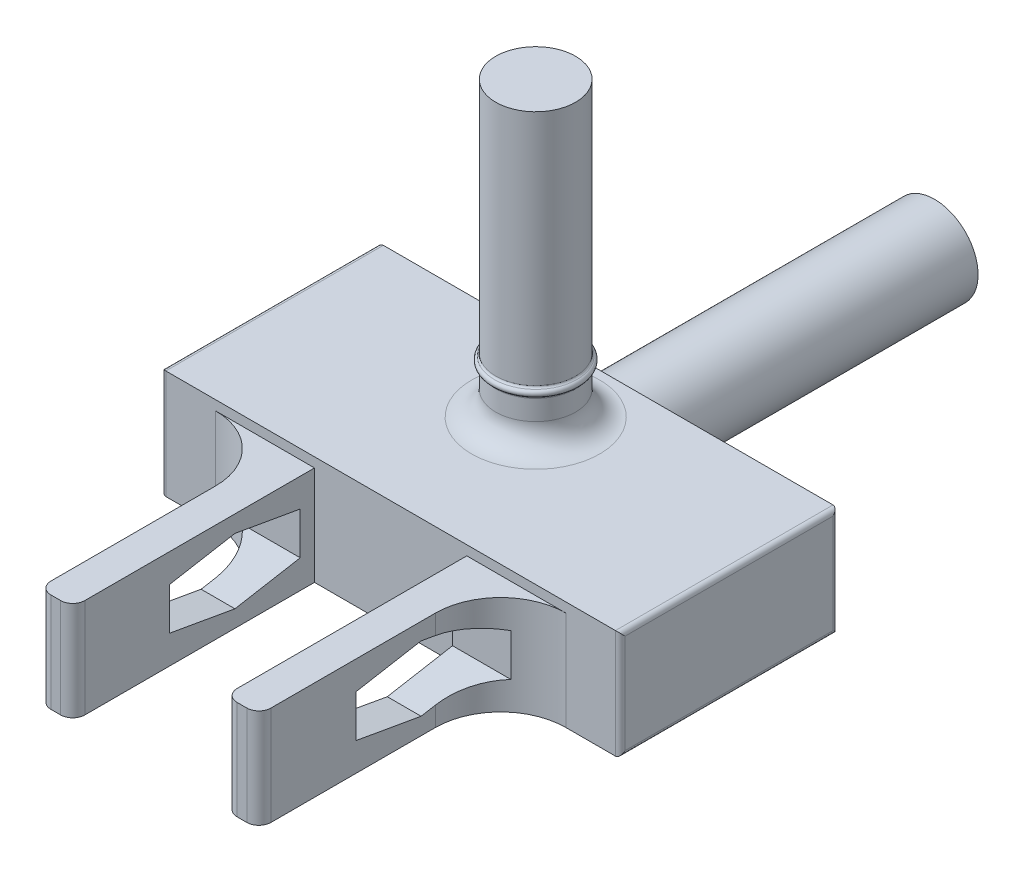
from build123d import *

# Parameters (mm, degrees)
DODANIE_WYCI_GNI_CIE1_DEPTH     = 4.5
DODANIE_WYCI_GNI_CIE2_DEPTH     = 4.1
SZKIC2_R                        = 1.8
DODANIE_WYCI_GNI_CIE3_DEPTH     = 13.5
WYTNIJ_WYCI_GNI_CIE2_DEPTH      = 23.456012558
WYTNIJ_WYCI_GNI_CIE2_DEPTH_BACK = 23.456012558
ZAOKR_GLENIE1_R                 = 0.5
ZAOKR_GLENIE2_R                 = 0.2
SZKIC4_R                        = 1.65
DODANIE_WYCI_GNI_CIE4_DEPTH     = 5.1
SZKIC5_R                        = 1.65
DODANIE_WYCI_GNI_CIE5_DEPTH     = 7
ZAOKR_GLENIE4_R                 = 1
SZKIC6_R                        = 0.15
ZAOKR_GLENIE6_R                 = 0.1


with BuildPart() as part:
    # Szkic1 → Dodanie-wyciągnięcie1 (new body)
    with BuildSketch(Plane(origin=(0, 0, 0), x_dir=(1, 0, 0), z_dir=(0, 1, 0))):
        Polygon((3.15, -4.5), (4.55, -4.5), (7.25, -4.5), (9.5, -4.5), (9.5, 4.5), (2.579268293, 4.5), (-2.579268293, 4.5), (-9.5, 4.5), (-9.5, -4.5), (-7.25, -4.5), (-4.55, -4.5), (-3.15, -4.5), align=None)
    extrude(amount=DODANIE_WYCI_GNI_CIE1_DEPTH)

    # Szkic1<7> → Dodanie-wyciągnięcie2 (add)
    with BuildSketch(Plane(origin=(0, 0, 0), x_dir=(1, 0, 0), z_dir=(0, 1, 0))):
        with BuildLine():
            Line((4.55, -14.5), (4.55, -7.2))
            ThreePointArc((4.55, -7.2), (5.340811691, -5.290811691), (7.25, -4.5))
            Line((7.25, -4.5), (3.15, -4.5))
            Line((3.15, -4.5), (3.15, -14.5))
            Line((3.15, -14.5), (4.55, -14.5))
        make_face()
        with BuildLine():
            Line((-3.15, -14.5), (-3.15, -4.5))
            Line((-3.15, -4.5), (-7.25, -4.5))
            ThreePointArc((-7.25, -4.5), (-5.340811691, -5.290811691), (-4.55, -7.2))
            Line((-4.55, -7.2), (-4.55, -14.5))
            Line((-4.55, -14.5), (-3.15, -14.5))
        make_face()
    extrude(amount=DODANIE_WYCI_GNI_CIE2_DEPTH)

    # Szkic2 → Dodanie-wyciągnięcie3 (add)
    with BuildSketch(Plane(origin=(0, 0, -4.5), x_dir=(-1, 0, 0), z_dir=(0, 0, -1))):
        with Locations((0, 2.25)):
            Circle(SZKIC2_R)
    extrude(amount=DODANIE_WYCI_GNI_CIE3_DEPTH)

    # Szkic3 → Wytnij-wyciągnięcie2 (cut, two sides: drawn at the far end of the back side and taken through both)
    with BuildSketch(Plane(origin=(-3.15, 0, 0), x_dir=(0, 0, -1), z_dir=(1, 0, 0)).offset(-WYTNIJ_WYCI_GNI_CIE2_DEPTH_BACK)):
        Polygon((-7.790001582, 3.4), (-10.490001582, 2.923917152), (-10.490001582, 1.176082848), (-7.790001582, 0.7), (-5.090001582, 1.176082848), (-5.090001582, 2.923917152), align=None)
    extrude(amount=WYTNIJ_WYCI_GNI_CIE2_DEPTH + WYTNIJ_WYCI_GNI_CIE2_DEPTH_BACK, mode=Mode.SUBTRACT)

    # Zaokrąglenie1
    zaokr_glenie1_edges = [part.edges().sort_by_distance(p)[0] for p in [
        (3.15, 2.05, 14.5),
        (4.55, 2.05, 14.5),
        (-4.55, 2.05, 14.5),
        (-3.15, 2.05, 14.5),
    ]]
    fillet(zaokr_glenie1_edges, radius=ZAOKR_GLENIE1_R)

    # Zaokrąglenie2
    zaokr_glenie2_edges = [part.edges().sort_by_distance(p)[0] for p in [
        (-9.5, 2.25, -4.5),
        (-9.5, 4.5, 0),
        (9.5, 0, 0),
        (-9.5, 2.25, 4.5),
        (9.5, 2.25, 4.5),
        (9.5, 2.25, -4.5),
        (9.5, 4.5, 0),
        (-9.5, 0, 0),
    ]]
    fillet(zaokr_glenie2_edges, radius=ZAOKR_GLENIE2_R)

    # Szkic4 → Dodanie-wyciągnięcie4 (add)
    with BuildSketch(Plane(origin=(0, 4.5, 0), x_dir=(1, 0, 0), z_dir=(0, 1, 0))):
        with Locations((0, 1.5)):
            Circle(SZKIC4_R)
    extrude(amount=DODANIE_WYCI_GNI_CIE4_DEPTH)

    # Szkic5 → Dodanie-wyciągnięcie5 (add)
    with BuildSketch(Plane(origin=(0, 9.6, 0), x_dir=(1, 0, 0), z_dir=(0, 1, 0))):
        with Locations((0, 1.5)):
            Circle(SZKIC5_R)
    extrude(amount=DODANIE_WYCI_GNI_CIE5_DEPTH)

    # Zaokrąglenie4
    zaokr_glenie4_edges = [part.edges().sort_by_distance(p)[0] for p in [
        (-1.65, 4.5, -1.5),
    ]]
    fillet(zaokr_glenie4_edges, radius=ZAOKR_GLENIE4_R)

    # Szkic6 → Obrót1 (revolve)
    with BuildSketch(Plane(origin=(0, 0, 0), x_dir=(0, 0, -1), z_dir=(1, 0, 0))):
        with Locations((-0.15, 6.559329456)):
            Circle(SZKIC6_R)
    revolve(axis=Axis((0, 16.6, -1.5), (0, -1, 0)))

    # Zaokrąglenie6
    zaokr_glenie6_edges = [part.edges().sort_by_distance(p)[0] for p in [
        (-1.166726189, 6.709329456, -2.666726189),
        (1.166726189, 6.409329456, -0.333273811),
    ]]
    fillet(zaokr_glenie6_edges, radius=ZAOKR_GLENIE6_R)


solid = part.part
